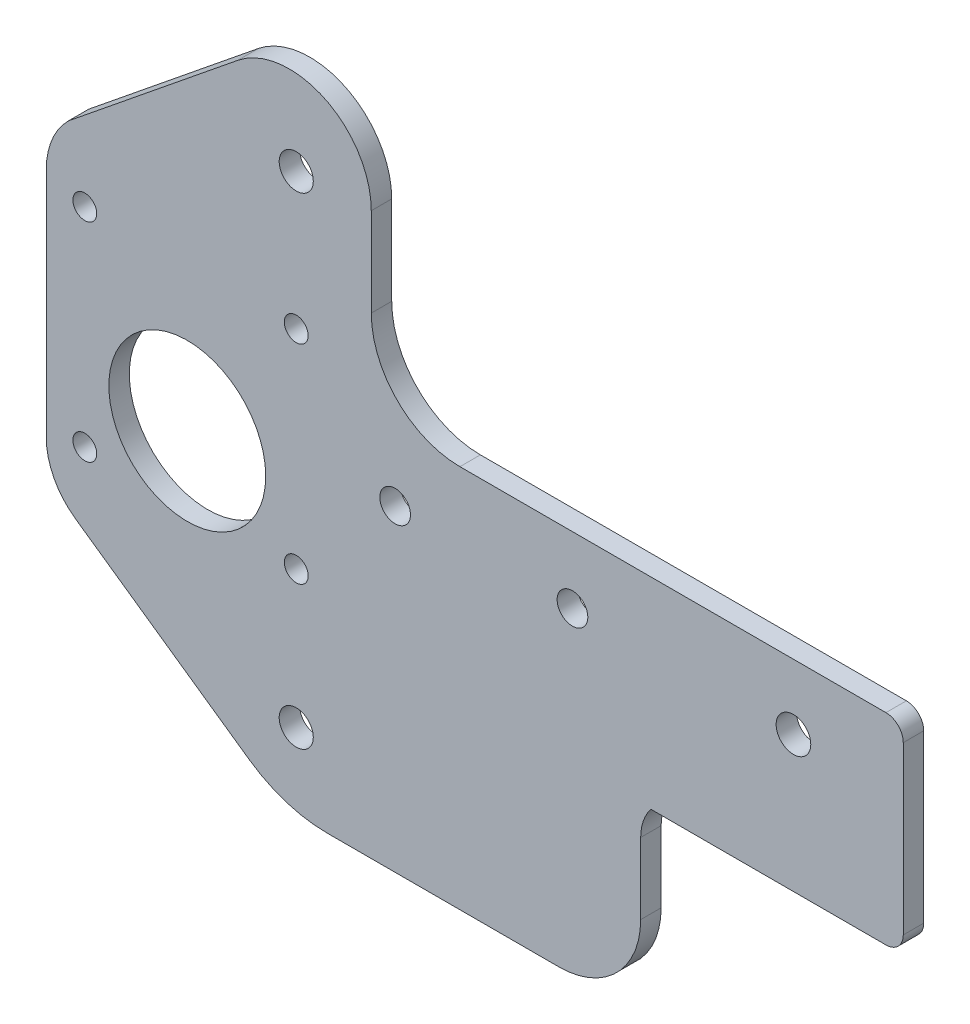
from build123d import *

# Parameters (mm, degrees)
SKETCH1_R           = 2.54
SKETCH1_R_2         = 2.25
SKETCH1_R_3         = 1.75
SKETCH1_R_4         = 2.5
SKETCH1_R_5         = 11.5
BOSS_EXTRUDE1_DEPTH = 3
FILLET2_R           = 2.54


with BuildPart() as part:
    # Sketch1 → Boss-Extrude1 (new body)
    with BuildSketch(Plane.XY):
        with BuildLine():
            Line((0, 0), (0, -29.5))
            Line((0, -29.5), (-37, -29.5))
            ThreePointArc((-37, -29.5), (-38.114378278, -31.538839171), (-38.5, -33.830127019))
            Line((-38.5, -33.830127019), (-38.5, -44.26209895))
            ThreePointArc((-38.5, -44.26209895), (-42.014718626, -52.747380324), (-50.5, -56.26209895))
            Line((-50.5, -56.26209895), (-84.414235636, -56.26209895))
            ThreePointArc((-84.414235636, -56.26209895), (-90.428351627, -55.336437965), (-95.885764364, -52.645139836))
            Line((-95.885764364, -52.645139836), (-121.385764364, -34.789847611))
            ThreePointArc((-121.385764364, -34.789847611), (-124.520108332, -31.215813301), (-125.65, -26.598327168))
            Line((-125.65, -26.598327168), (-125.65, 7.401672832))
            ThreePointArc((-125.65, 7.401672832), (-124.8106021, 11.616191188), (-122.420515459, 15.187499024))
            Line((-122.420515459, 15.187499024), (-97.551844693, 35.325751537))
            ThreePointArc((-97.551844693, 35.325751537), (-84.833866838, 36.831023412), (-78, 26))
            Line((-78, 26), (-78, 13))
            ThreePointArc((-78, 13), (-74.192388155, 3.807611845), (-65, 0))
            Line((-65, 0), (0, 0))
        make_face()
        with Locations((-16.102, -9.552)):
            Circle(SKETCH1_R, mode=Mode.SUBTRACT)
        with Locations((-48.5, -9.75)):
            Circle(SKETCH1_R_2, mode=Mode.SUBTRACT)
        with Locations((-74.5, -9.75)):
            Circle(SKETCH1_R_2, mode=Mode.SUBTRACT)
        with Locations((-89, 5.5)):
            Circle(SKETCH1_R_3, mode=Mode.SUBTRACT)
        with Locations((-89, 25.5)):
            Circle(SKETCH1_R_4, mode=Mode.SUBTRACT)
        with Locations((-89, -25)):
            Circle(SKETCH1_R_3, mode=Mode.SUBTRACT)
        with Locations((-89, -45.112)):
            Circle(SKETCH1_R_4, mode=Mode.SUBTRACT)
        with Locations((-104.975027079, -15.450324944)):
            Circle(SKETCH1_R_5, mode=Mode.SUBTRACT)
        with Locations((-120, 5.5)):
            Circle(SKETCH1_R_3, mode=Mode.SUBTRACT)
        with Locations((-120, -25)):
            Circle(SKETCH1_R_3, mode=Mode.SUBTRACT)
    extrude(amount=BOSS_EXTRUDE1_DEPTH)

    # Fillet2
    fillet2_edges = [part.edges().sort_by_distance(p)[0] for p in [
        (0, 0, 1.5),
        (0, -29.5, 1.5),
    ]]
    fillet(fillet2_edges, radius=FILLET2_R)


solid = part.part
